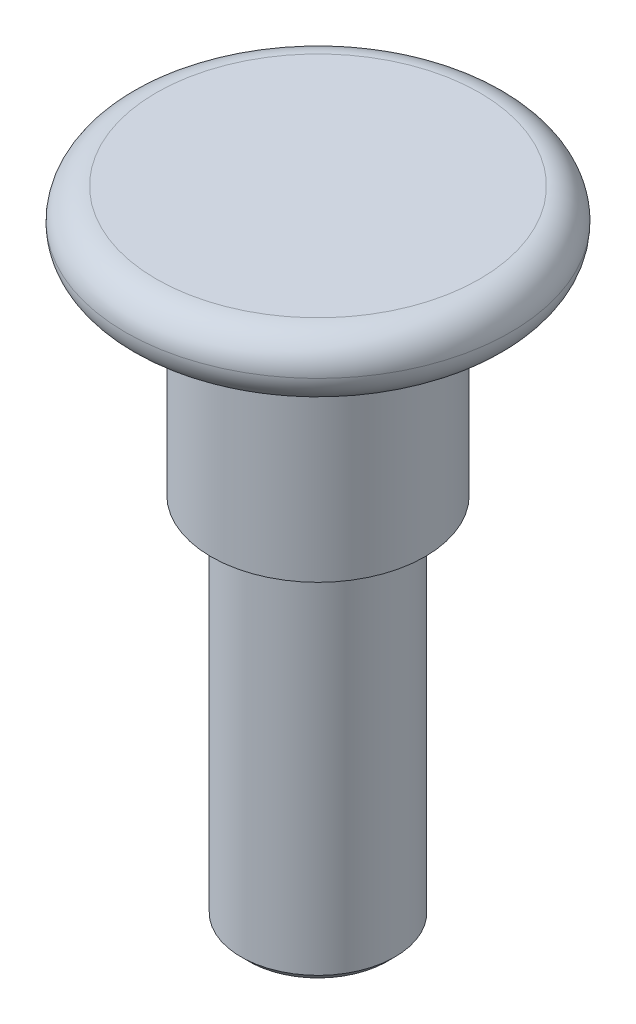
from build123d import *

# Parameters (mm, degrees)
FILETE1_R     = 2
CHANFRO1_SIZE = 0.5


with BuildPart() as part:
    # Esboço1 → Revolução1 (revolve)
    with BuildSketch(Plane.XY, mode=Mode.PRIVATE) as revolu_o1_sk:
        Polygon((0, 57.501605759), (12.5, 57.501605759), (12.5, 53.501605759), (6.95, 53.501605759), (6.95, 40.101605759), (5, 40.101605759), (5, 16.101605759), (0, 16.101605759), align=None)
    revolve(revolu_o1_sk.sketch.rotate(Axis((0, -51.285215947, 0), (0, 1, 0)), 90), axis=Axis((0, -51.285215947, 0), (0, 1, 0)))

    # Filete1
    filete1_edges = [part.edges().sort_by_distance(p)[0] for p in [
        (0, 53.501605759, 12.5),
        (0, 57.501605759, 12.5),
    ]]
    fillet(filete1_edges, radius=FILETE1_R - 0.0001)  # a hair under: the kernel refuses the full size

    # Chanfro1
    chanfro1_edges = [part.edges().sort_by_distance(p)[0] for p in [
        (0, 16.101605759, 5),
    ]]
    chamfer(chanfro1_edges, length=CHANFRO1_SIZE)


solid = part.part
